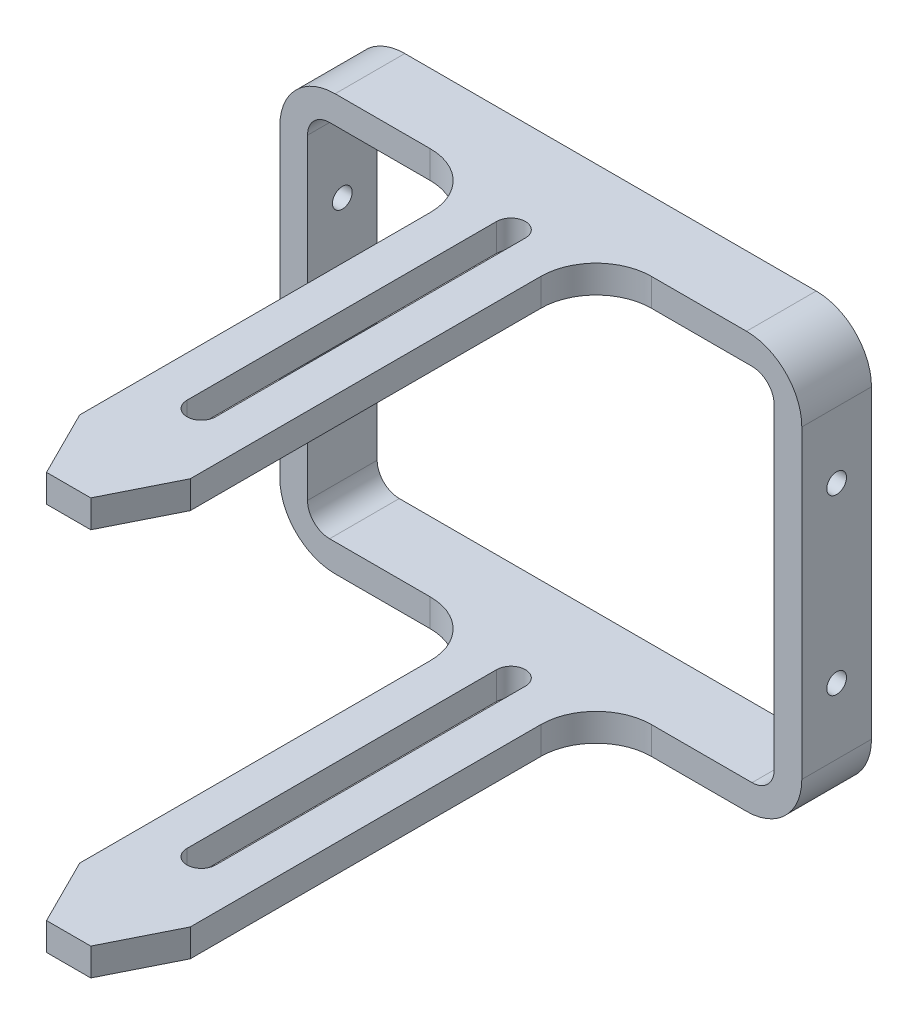
from build123d import *

# Parameters (mm, degrees)
SKETCH1_W             = 59.944
SKETCH1_H             = 47.752
SKETCH1_W_2           = 53.594
SKETCH1_H_2           = 41.402
BOSS_EXTRUDE1_DEPTH   = 8.001
BOSS_EXTRUDE2_DEPTH   = 3.175
CUT_EXTRUDE1_DEPTH    = 3.302
F_4_40_TAPPED_HOLE1_D = 2.2606
FILLET1_R             = 6.35
FILLET2_R             = 2.54
FILLET3_R             = 6.35


with BuildPart() as part:
    # Sketch1 → Boss-Extrude1 (new body)
    with BuildSketch(Plane.XY):
        Rectangle(SKETCH1_W, SKETCH1_H)
        Rectangle(SKETCH1_W_2, SKETCH1_H_2, mode=Mode.SUBTRACT)
    extrude(amount=BOSS_EXTRUDE1_DEPTH)

    # Sketch2 → Boss-Extrude2 (add)
    with BuildSketch(Plane(origin=(0, 23.876, 0), x_dir=(1, 0, 0), z_dir=(0, 1, 0))):
        Polygon((-6.35, -8.001), (-6.35, -54.61), (-2.54, -62.23), (2.54, -62.23), (6.35, -54.61), (6.35, -8.001), align=None)
    boss_extrude2 = extrude(amount=-BOSS_EXTRUDE2_DEPTH)

    # Sketch3 → Cut-Extrude1 (cut)
    with BuildSketch(Plane(origin=(0, 23.876, 0), x_dir=(1, 0, 0), z_dir=(0, 1, 0))):
        with BuildLine():
            Line((-1.651, -46.99), (-1.651, -11.43))
            ThreePointArc((-1.651, -11.43), (0, -9.779), (1.651, -11.43))
            Line((1.651, -11.43), (1.651, -46.99))
            ThreePointArc((1.651, -46.99), (0, -48.641), (-1.651, -46.99))
        make_face()
    cut_extrude1 = extrude(amount=-CUT_EXTRUDE1_DEPTH, mode=Mode.SUBTRACT)

    # Mirror1: Boss-Extrude2, Cut-Extrude1 across plane
    add(boss_extrude2.mirror(Plane.ZX))
    add(cut_extrude1.mirror(Plane.ZX), mode=Mode.SUBTRACT)

    # #4-40 Tapped Hole1 (through all)
    with Locations(Plane.ZY.offset(29.972)):
        with Locations((4.0005, 9.9441), (4.0005, -9.9441)):
            Hole(F_4_40_TAPPED_HOLE1_D / 2)

    # Fillet1
    fillet1_edges = [part.edges().sort_by_distance(p)[0] for p in [
        (29.972, -23.876, 4.0005),
        (29.972, 23.876, 4.0005),
        (-29.972, -23.876, 4.0005),
        (-29.972, 23.876, 4.0005),
    ]]
    fillet(fillet1_edges, radius=FILLET1_R)

    # Fillet2
    fillet2_edges = [part.edges().sort_by_distance(p)[0] for p in [
        (-26.797, -20.701, 4.0005),
        (-26.797, 20.701, 4.0005),
        (26.797, -20.701, 4.0005),
        (26.797, 20.701, 4.0005),
    ]]
    fillet(fillet2_edges, radius=FILLET2_R)

    # Fillet3
    fillet3_edges = [part.edges().sort_by_distance(p)[0] for p in [
        (6.35, 22.2885, 8.001),
        (6.35, -22.2885, 8.001),
        (-6.35, 22.2885, 8.001),
        (-6.35, -22.2885, 8.001),
    ]]
    fillet(fillet3_edges, radius=FILLET3_R)


solid = part.part
